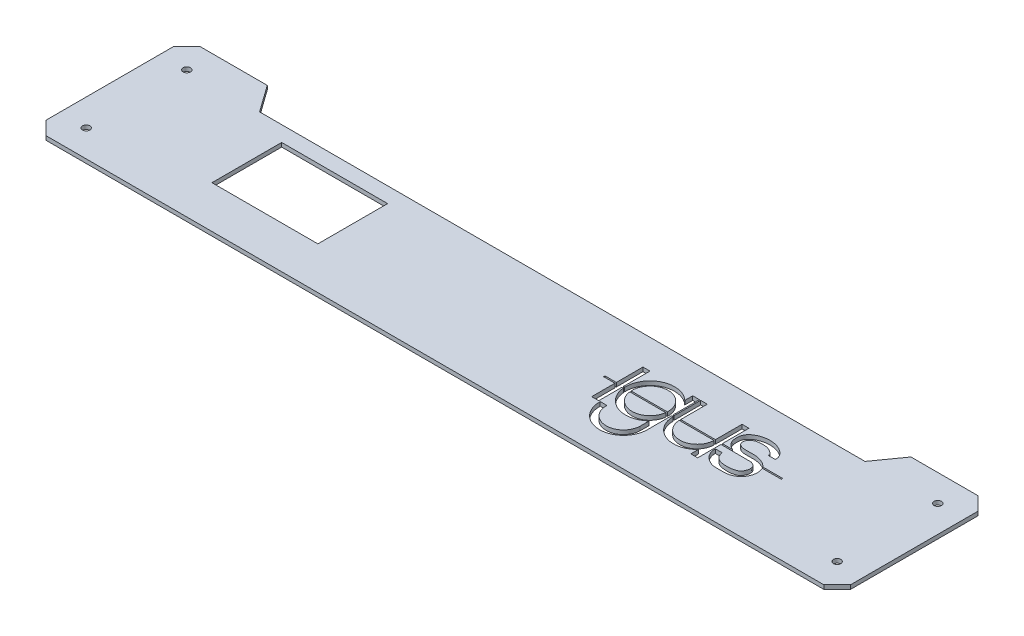
from build123d import *

# Parameters (mm, degrees)
SKETCH1_R           = 2.75
BOSS_EXTRUDE1_DEPTH = 3
CUT_EXTRUDE1_DEPTH  = 494
SKETCH3_W           = 79
SKETCH3_H           = 52
CUT_EXTRUDE2_DEPTH  = 10


with BuildPart() as part:
    # Sketch1 → Boss-Extrude1 (new body)
    with BuildSketch(Plane(origin=(0, 0, 0), x_dir=(1, 0, 0), z_dir=(0, 1, 0))):
        Polygon((14.619315376, 0), (64.619315376, 0), (78.894940901, -20), (530.343689851, -20), (544.619315376, 0), (594.619315376, 0), (604.619315376, -10), (604.619315376, -105), (594.619315376, -115), (544.619315376, -115), (64.619315376, -115), (14.619315376, -115), (4.619315376, -105), (4.619315376, -10), align=None)
        with Locations((24.619315376, -20)):
            Circle(SKETCH1_R, mode=Mode.SUBTRACT)
        with Locations((24.619315376, -95)):
            Circle(SKETCH1_R, mode=Mode.SUBTRACT)
        with Locations((584.619315376, -95)):
            Circle(SKETCH1_R, mode=Mode.SUBTRACT)
        with Locations((584.619315376, -20)):
            Circle(SKETCH1_R, mode=Mode.SUBTRACT)
    extrude(amount=BOSS_EXTRUDE1_DEPTH)

    # Sketch2 → Cut-Extrude1 (cut)
    with BuildSketch(Plane(origin=(0, 3, 0), x_dir=(1, 0, 0), z_dir=(0, 1, 0))):
        with BuildLine():
            Line((398.002119112, -80.076819118), (393.00270081, -80.076819118))
            ThreePointArc((393.00270081, -80.076819118), (410.316456421, -98.498051436), (428.73768874, -81.184295825))
            Line((428.73768874, -81.184295825), (428.73768874, -62.754542196))
            Line((428.73768874, -62.754542196), (429.828410223, -62.754542196))
            ThreePointArc((429.828410223, -62.754542196), (441.263270171, -78.892317867), (460.524654776, -74.399780865))
            Line((460.524654776, -74.399780865), (460.524654776, -80.076819118))
            Line((460.524654776, -80.076819118), (465.660554794, -80.076819118))
            Line((465.660554794, -80.076819118), (465.660554794, -62.754542196))
            Line((465.660554794, -62.754542196), (488.417944181, -62.855108717))
            add(Edge.make_bspline(
                [(471.65979143, -67.670234055), (471.467349037, -68.646289122), (472.079971263, -69.787073511), (472.75073467, -71.328334093), (473.670793108, -72.142703983), (474.731506552, -73.17837262), (476.26675861, -73.965460053), (478.30593381, -74.512399305), (480.63667293, -74.705574625), (483.281199386, -74.769793815), (485.889933101, -74.527747245), (488.211391914, -73.733498343), (490.455228526, -72.719383895), (491.526175492, -70.590370359), (492.370540737, -68.546977205), (492.272585959, -66.544136837), (491.572707864, -64.014873745), (489.373868115, -63.411195717), (488.417944181, -62.855108717)],
                knots=[0, 0, 0, 0, 0.081184108, 0.10790483, 0.143900876, 0.185103716, 0.23586594, 0.290215762, 0.366526158, 0.436729253, 0.51873906, 0.590001951, 0.649430214, 0.723575416, 0.786665555, 0.838093389, 0.894821875, 1, 1, 1, 1], degree=3))
            Line((471.65979143, -67.670234055), (466.527025714, -67.670234055))
            add(Edge.make_bspline(
                [(496.465712365, -62.754542196), (496.556977024, -62.920783862), (497.154806756, -64.113814796), (497.675924436, -66.848005681), (497.311914035, -70.780078344), (495.575446493, -74.301968213), (492.98720979, -77.098696092), (489.940908772, -78.771690205), (486.694478373, -79.50921288), (483.053674793, -79.684304385), (479.203565525, -79.74368695), (475.393522247, -79.36720183), (472.390086365, -77.723772723), (469.576953675, -75.999956627), (467.190123208, -72.425986535), (466.247518724, -69.586943049), (466.527025714, -67.670234055)],
                knots=[0.511379909, 0.511379909, 0.511379909, 0.511379909, 0.516990878, 0.550897762, 0.592186626, 0.63231135, 0.665073685, 0.704086852, 0.733344431, 0.763283971, 0.812029986, 0.848328531, 0.874618577, 0.91298076, 0.944693495, 1, 1, 1, 1], degree=3))
            Line((496.465712365, -62.754542196), (510.681758941, -62.754542196))
            Line((510.681758941, -62.754542196), (510.681758941, -61.687313229))
            Line((510.681758941, -61.687313229), (495.762116862, -61.687313229))
            add(Edge.make_bspline(
                [(490.38889617, -52.214376993), (490.666192943, -51.358432785), (489.79050483, -50.022415821), (487.932067858, -48.843148452), (485.54645635, -47.510297539), (482.562260426, -47.043421476), (479.134677609, -47.158975955), (476.068218203, -47.614807116), (473.488258648, -49.377581885), (472.04812259, -51.653010333), (471.984618877, -54.16781745), (473.478287973, -55.992395301), (477.47064832, -57.607026677), (483.363758542, -56.560367271), (489.741283998, -57.625951926), (493.725072166, -59.531757921), (495.302235724, -61.095199397), (495.762116862, -61.687313229)],
                knots=[0, 0, 0, 0, 0.023973978, 0.04290032, 0.065706797, 0.10450496, 0.130316026, 0.168033853, 0.194385522, 0.220521746, 0.245718615, 0.26280001, 0.287259547, 0.369622478, 0.434467432, 0.476788021, 0.498807658, 0.498807658, 0.498807658, 0.498807658], degree=3))
            Line((490.38889617, -52.214376993), (495.664673576, -52.214376993))
            add(Edge.make_bspline(
                [(495.664673576, -52.214376993), (495.919639332, -48.412828628), (490.437193219, -42.931253515), (480.799393591, -41.213342373), (473.004306785, -43.124237957), (467.515587473, -47.653871227), (467.024877851, -52.639692563), (467.80487049, -58.095251596), (470.959295633, -60.815942731), (473.382272533, -61.687313229)],
                knots=[0, 0, 0, 0, 0.214336098, 0.393230308, 0.565847142, 0.676110279, 0.787926735, 0.842679623, 1, 1, 1, 1], degree=3))
            Line((473.382272533, -61.687313229), (465.660554794, -61.687313229))
            Line((465.660554794, -61.687313229), (465.660554794, -41.847451799))
            Line((465.660554794, -41.847451799), (460.524654776, -41.847451799))
            Line((460.524654776, -41.847451799), (460.524654776, -61.687313229))
            Line((460.524654776, -61.687313229), (434.585527347, -61.687313229))
            Line((434.585527347, -61.687313229), (434.585527347, -41.8474518))
            Line((434.585527347, -41.8474518), (429.6271558, -41.8474518))
            Line((429.6271558, -41.8474518), (429.6271558, -61.687313229))
            Line((429.6271558, -61.687313229), (428.73768874, -61.687313229))
            Line((428.73768874, -61.687313229), (428.73768874, -41.8474518))
            Line((428.73768874, -41.8474518), (423.738270438, -41.8474518))
            Line((423.738270438, -41.8474518), (423.738270438, -47.786335651))
            ThreePointArc((423.738270438, -47.786335651), (403.611105615, -44.349438795), (392.826248922, -61.687313229))
            Line((392.826248922, -61.687313229), (391.847895604, -61.687313229))
            Line((391.847895604, -61.687313229), (391.847895604, -41.847451799))
            Line((391.847895604, -41.847451799), (386.612349176, -41.847451799))
            Line((386.612349176, -41.847451799), (386.612349176, -61.687313229))
            Line((386.612349176, -61.687313229), (378.212990315, -61.687313229))
            Line((378.212990315, -61.687313229), (378.212990315, -62.754542196))
            Line((378.212990315, -62.754542196), (386.612349176, -62.754542196))
            Line((386.612349176, -62.754542196), (386.612349176, -80.076819118))
            Line((386.612349176, -80.076819118), (391.847895604, -80.076819118))
            Line((391.847895604, -80.076819118), (391.847895604, -62.754542196))
            Line((391.847895604, -62.754542196), (392.8951588, -62.754542196))
            ThreePointArc((392.8951588, -62.754542196), (404.702292582, -78.183742443), (423.738270438, -74.297848013))
            Line((423.738270438, -74.297848013), (423.738270438, -81.184295825))
            ThreePointArc((423.738270438, -81.184295825), (410.316456421, -93.498633134), (398.002119112, -80.076819118))
        make_face()
        with BuildLine():
            ThreePointArc((424.536912506, -62.754542196), (411.117706096, -74.570121508), (397.698499686, -62.754542196))
            Line((397.698499686, -62.754542196), (424.536912506, -62.754542196))
        make_face(mode=Mode.SUBTRACT)
        with BuildLine():
            Line((424.630340047, -61.687313229), (397.605072146, -61.687313229))
            ThreePointArc((397.605072146, -61.687313229), (411.117706096, -47.514062156), (424.630340047, -61.687313229))
        make_face(mode=Mode.SUBTRACT)
        with BuildLine():
            Line((434.586139201, -62.754542196), (460.51725233, -62.754542196))
            ThreePointArc((460.51725233, -62.754542196), (447.551695765, -75.289313484), (434.586139201, -62.754542196))
        make_face(mode=Mode.SUBTRACT)
    extrude(amount=-CUT_EXTRUDE1_DEPTH, mode=Mode.SUBTRACT)


with BuildPart() as cut_extrude1_piece_1:
    # of the separate pieces the step leaves, piece 1, a body of its own (cut_extrude1_pieces)
    add(part.part.solids().sort_by_distance((14.619315376, 0, 0))[0])

    # Sketch3 → Cut-Extrude2 (cut)
    with BuildSketch(Plane(origin=(0, 3, 0), x_dir=(1, 0, 0), z_dir=(0, 1, 0))):
        with Locations((146.360700612, -57.5)):
            Rectangle(SKETCH3_W, SKETCH3_H)
    extrude(amount=-CUT_EXTRUDE2_DEPTH, mode=Mode.SUBTRACT)


with BuildPart() as cut_extrude1_piece_2:
    # of the separate pieces the step leaves, piece 2, a body of its own (cut_extrude1_pieces)
    add(part.part.solids().sort_by_distance((424.630340047, 0, 61.687313229))[0])


with BuildPart() as cut_extrude1_piece_3:
    # of the separate pieces the step leaves, piece 3, a body of its own (cut_extrude1_pieces)
    add(part.part.solids().sort_by_distance((434.586139201, 0, 62.754542196))[0])


with BuildPart() as cut_extrude1_piece_4:
    # of the separate pieces the step leaves, piece 4, a body of its own (cut_extrude1_pieces)
    add(part.part.solids().sort_by_distance((424.536912506, 0, 62.754542196))[0])


solid = Compound([cut_extrude1_piece_1.part, cut_extrude1_piece_2.part, cut_extrude1_piece_3.part, cut_extrude1_piece_4.part])
